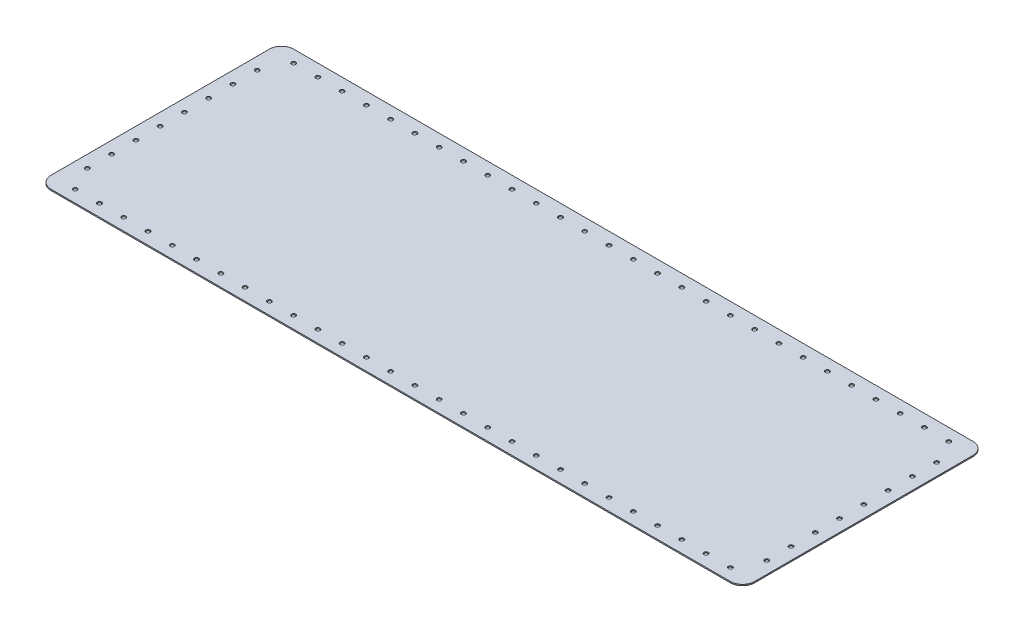
from build123d import *

# Parameters (mm, degrees)
SKETCH1_W                      = 580
SKETCH1_H                      = 200
BOSS_EXTRUDE1_DEPTH            = 1
FILLET1_R                      = 10
M3_CLEARANCE_HOLE1_AT_2_COUNT  = 2
M3_CLEARANCE_HOLE1_AT_2_PITCH  = 22.360679775
M3_CLEARANCE_HOLE1_AT_3_COUNT  = 2
M3_CLEARANCE_HOLE1_AT_3_PITCH  = 36.055512755
M3_CLEARANCE_HOLE1_AT_4_COUNT  = 2
M3_CLEARANCE_HOLE1_AT_4_PITCH  = 53.851648071
M3_CLEARANCE_HOLE1_AT_5_COUNT  = 2
M3_CLEARANCE_HOLE1_AT_5_PITCH  = 72.801098893
M3_CLEARANCE_HOLE1_AT_6_COUNT  = 2
M3_CLEARANCE_HOLE1_AT_6_PITCH  = 92.195444573
M3_CLEARANCE_HOLE1_AT_7_COUNT  = 2
M3_CLEARANCE_HOLE1_AT_7_PITCH  = 111.803398875
M3_CLEARANCE_HOLE1_AT_8_COUNT  = 2
M3_CLEARANCE_HOLE1_AT_8_PITCH  = 131.52946438
M3_CLEARANCE_HOLE1_AT_9_COUNT  = 2
M3_CLEARANCE_HOLE1_AT_9_PITCH  = 151.327459504
M3_CLEARANCE_HOLE1_AT_10_COUNT = 2
M3_CLEARANCE_HOLE1_AT_10_PITCH = 171.172427686
M3_CLEARANCE_HOLE1_AT_11_COUNT = 2
M3_CLEARANCE_HOLE1_AT_11_PITCH = 191.049731745
M3_CLEARANCE_HOLE1_AT_12_COUNT = 2
M3_CLEARANCE_HOLE1_AT_12_PITCH = 210.950231097
M3_CLEARANCE_HOLE1_AT_13_COUNT = 2
M3_CLEARANCE_HOLE1_AT_13_PITCH = 230.867927612
M3_CLEARANCE_HOLE1_AT_14_COUNT = 2
M3_CLEARANCE_HOLE1_AT_14_PITCH = 250.79872408
M3_CLEARANCE_HOLE1_AT_15_COUNT = 2
M3_CLEARANCE_HOLE1_AT_15_PITCH = 270.739727414
M3_CLEARANCE_HOLE1_AT_16_COUNT = 2
M3_CLEARANCE_HOLE1_AT_16_PITCH = 290.688837075
M3_CLEARANCE_HOLE1_AT_17_COUNT = 2
M3_CLEARANCE_HOLE1_AT_17_PITCH = 310.64449134
M3_CLEARANCE_HOLE1_AT_18_COUNT = 2
M3_CLEARANCE_HOLE1_AT_18_PITCH = 330.605505096
M3_CLEARANCE_HOLE1_AT_19_COUNT = 2
M3_CLEARANCE_HOLE1_AT_19_PITCH = 350.570962859
M3_CLEARANCE_HOLE1_AT_20_COUNT = 2
M3_CLEARANCE_HOLE1_AT_20_PITCH = 370.540146273
M3_CLEARANCE_HOLE1_AT_21_COUNT = 2
M3_CLEARANCE_HOLE1_AT_21_PITCH = 390.512483795
M3_CLEARANCE_HOLE1_AT_22_COUNT = 2
M3_CLEARANCE_HOLE1_AT_22_PITCH = 410.487515035
M3_CLEARANCE_HOLE1_AT_23_COUNT = 2
M3_CLEARANCE_HOLE1_AT_23_PITCH = 430.464865001
M3_CLEARANCE_HOLE1_AT_24_COUNT = 2
M3_CLEARANCE_HOLE1_AT_24_PITCH = 450.444225182
M3_CLEARANCE_HOLE1_AT_25_COUNT = 2
M3_CLEARANCE_HOLE1_AT_25_PITCH = 470.425339454
M3_CLEARANCE_HOLE1_AT_26_COUNT = 2
M3_CLEARANCE_HOLE1_AT_26_PITCH = 490.40799341
M3_CLEARANCE_HOLE1_AT_27_COUNT = 2
M3_CLEARANCE_HOLE1_AT_27_PITCH = 510.392006207
M3_CLEARANCE_HOLE1_AT_28_COUNT = 2
M3_CLEARANCE_HOLE1_AT_28_PITCH = 530.377224247
M3_CLEARANCE_HOLE1_AT_29_COUNT = 2
M3_CLEARANCE_HOLE1_AT_29_PITCH = 550.363516233
M3_CLEARANCE_HOLE1_AT_30_COUNT = 2
M3_CLEARANCE_HOLE1_AT_30_PITCH = 19.996953903
M3_CLEARANCE_HOLE1_AT_31_COUNT = 2
M3_CLEARANCE_HOLE1_AT_31_PITCH = 39.993907806
M3_CLEARANCE_HOLE1_AT_32_COUNT = 2
M3_CLEARANCE_HOLE1_AT_32_PITCH = 59.990861709
M3_CLEARANCE_HOLE1_AT_33_COUNT = 2
M3_CLEARANCE_HOLE1_AT_33_PITCH = 79.987815613
M3_CLEARANCE_HOLE1_AT_34_COUNT = 2
M3_CLEARANCE_HOLE1_AT_34_PITCH = 99.984769516
M3_CLEARANCE_HOLE1_AT_35_COUNT = 2
M3_CLEARANCE_HOLE1_AT_35_PITCH = 119.981723419
M3_CLEARANCE_HOLE1_AT_36_COUNT = 2
M3_CLEARANCE_HOLE1_AT_36_PITCH = 139.978677322
M3_CLEARANCE_HOLE1_AT_37_COUNT = 2
M3_CLEARANCE_HOLE1_AT_37_PITCH = 160.312195419
M3_CLEARANCE_HOLE1_AT_38_COUNT = 2
M3_CLEARANCE_HOLE1_AT_38_PITCH = 162.788205961
M3_CLEARANCE_HOLE1_AT_39_COUNT = 2
M3_CLEARANCE_HOLE1_AT_39_PITCH = 167.630546142
M3_CLEARANCE_HOLE1_AT_40_COUNT = 2
M3_CLEARANCE_HOLE1_AT_40_PITCH = 174.642491966
M3_CLEARANCE_HOLE1_AT_41_COUNT = 2
M3_CLEARANCE_HOLE1_AT_41_PITCH = 183.575597507
M3_CLEARANCE_HOLE1_AT_42_COUNT = 2
M3_CLEARANCE_HOLE1_AT_42_PITCH = 194.164878389
M3_CLEARANCE_HOLE1_AT_43_COUNT = 2
M3_CLEARANCE_HOLE1_AT_43_PITCH = 206.155281281
M3_CLEARANCE_HOLE1_AT_44_COUNT = 2
M3_CLEARANCE_HOLE1_AT_44_PITCH = 219.317121995
M3_CLEARANCE_HOLE1_AT_45_COUNT = 2
M3_CLEARANCE_HOLE1_AT_45_PITCH = 233.452350599
M3_CLEARANCE_HOLE1_AT_46_COUNT = 2
M3_CLEARANCE_HOLE1_AT_46_PITCH = 248.394846967
M3_CLEARANCE_HOLE1_AT_47_COUNT = 2
M3_CLEARANCE_HOLE1_AT_47_PITCH = 264.007575649
M3_CLEARANCE_HOLE1_AT_48_COUNT = 2
M3_CLEARANCE_HOLE1_AT_48_PITCH = 280.178514522
M3_CLEARANCE_HOLE1_AT_49_COUNT = 2
M3_CLEARANCE_HOLE1_AT_49_PITCH = 296.816441593
M3_CLEARANCE_HOLE1_AT_50_COUNT = 2
M3_CLEARANCE_HOLE1_AT_50_PITCH = 313.84709653
M3_CLEARANCE_HOLE1_AT_51_COUNT = 2
M3_CLEARANCE_HOLE1_AT_51_PITCH = 331.209903234
M3_CLEARANCE_HOLE1_AT_52_COUNT = 2
M3_CLEARANCE_HOLE1_AT_52_PITCH = 348.85527085
M3_CLEARANCE_HOLE1_AT_53_COUNT = 2
M3_CLEARANCE_HOLE1_AT_53_PITCH = 366.742416418
M3_CLEARANCE_HOLE1_AT_54_COUNT = 2
M3_CLEARANCE_HOLE1_AT_54_PITCH = 384.837628098
M3_CLEARANCE_HOLE1_AT_55_COUNT = 2
M3_CLEARANCE_HOLE1_AT_55_PITCH = 403.112887415
M3_CLEARANCE_HOLE1_AT_56_COUNT = 2
M3_CLEARANCE_HOLE1_AT_56_PITCH = 421.544778167
M3_CLEARANCE_HOLE1_AT_57_COUNT = 2
M3_CLEARANCE_HOLE1_AT_57_PITCH = 440.113621693
M3_CLEARANCE_HOLE1_AT_58_COUNT = 2
M3_CLEARANCE_HOLE1_AT_58_PITCH = 458.802789878
M3_CLEARANCE_HOLE1_AT_59_COUNT = 2
M3_CLEARANCE_HOLE1_AT_59_PITCH = 477.59815745
M3_CLEARANCE_HOLE1_AT_60_COUNT = 2
M3_CLEARANCE_HOLE1_AT_60_PITCH = 496.487663492
M3_CLEARANCE_HOLE1_AT_61_COUNT = 2
M3_CLEARANCE_HOLE1_AT_61_PITCH = 515.460958754
M3_CLEARANCE_HOLE1_AT_62_COUNT = 2
M3_CLEARANCE_HOLE1_AT_62_PITCH = 534.509120596
M3_CLEARANCE_HOLE1_AT_63_COUNT = 2
M3_CLEARANCE_HOLE1_AT_63_PITCH = 553.624421427
M3_CLEARANCE_HOLE1_AT_64_COUNT = 2
M3_CLEARANCE_HOLE1_AT_64_PITCH = 572.800139665
M3_CLEARANCE_HOLE1_AT_65_COUNT = 2
M3_CLEARANCE_HOLE1_AT_65_PITCH = 560
M3_CLEARANCE_HOLE1_AT_66_COUNT = 2
M3_CLEARANCE_HOLE1_AT_66_PITCH = 560.356920333
M3_CLEARANCE_HOLE1_AT_67_COUNT = 2
M3_CLEARANCE_HOLE1_AT_67_PITCH = 561.426319887
M3_CLEARANCE_HOLE1_AT_68_COUNT = 2
M3_CLEARANCE_HOLE1_AT_68_PITCH = 563.204140156
M3_CLEARANCE_HOLE1_AT_69_COUNT = 2
M3_CLEARANCE_HOLE1_AT_69_PITCH = 565.683701945
M3_CLEARANCE_HOLE1_AT_70_COUNT = 2
M3_CLEARANCE_HOLE1_AT_70_PITCH = 568.855828954
M3_CLEARANCE_HOLE1_AT_71_COUNT = 2
M3_CLEARANCE_HOLE1_AT_71_PITCH = 572.709013334
M3_CLEARANCE_HOLE1_AT_72_COUNT = 2
M3_CLEARANCE_HOLE1_AT_72_PITCH = 577.229616448


with BuildPart() as part:
    # Sketch1 → Boss-Extrude1 (new body)
    with BuildSketch(Plane(origin=(0, 0, 0), x_dir=(1, 0, 0), z_dir=(0, 1, 0))):
        Rectangle(SKETCH1_W, SKETCH1_H)
    extrude(amount=BOSS_EXTRUDE1_DEPTH)

    # Fillet1
    fillet1_edges = [part.edges().sort_by_distance(p)[0] for p in [
        (-290, 0.5, 100),
        (290, 0.5, 100),
        (290, 0.5, -100),
        (-290, 0.5, -100),
    ]]
    fillet(fillet1_edges, radius=FILLET1_R)

    # Sketch3 → M3 Clearance Hole1 (revolve, cut)
    with BuildSketch(Plane(origin=(280, 1, -70), x_dir=(0, 0, 1), z_dir=(1, 0, 0))):
        Polygon((0, 0), (0, 1), (1.7, 1), (1.7, 0.025), (1.725, 0), align=None)
    m3_clearance_hole1 = revolve(axis=Axis((280, 7.35, -70), (0, -1, 0)), mode=Mode.SUBTRACT)

    # M3 Clearance Hole1 at 2: M3 Clearance Hole1 ×2
    with Locations(*[Vector(-0.447213595499958, 0, -0.894427190999916) * (i * M3_CLEARANCE_HOLE1_AT_2_PITCH) for i in range(1, M3_CLEARANCE_HOLE1_AT_2_COUNT)]):
        add(m3_clearance_hole1, mode=Mode.SUBTRACT)

    # M3 Clearance Hole1 at 3: M3 Clearance Hole1 ×2
    with Locations(*[Vector(-0.8320502943378455, 0, -0.5547001962252264) * (i * M3_CLEARANCE_HOLE1_AT_3_PITCH) for i in range(1, M3_CLEARANCE_HOLE1_AT_3_COUNT)]):
        add(m3_clearance_hole1, mode=Mode.SUBTRACT)

    # M3 Clearance Hole1 at 4: M3 Clearance Hole1 ×2
    with Locations(*[Vector(-0.9284766908852612, 0, -0.37139067635409917) * (i * M3_CLEARANCE_HOLE1_AT_4_PITCH) for i in range(1, M3_CLEARANCE_HOLE1_AT_4_COUNT)]):
        add(m3_clearance_hole1, mode=Mode.SUBTRACT)

    # M3 Clearance Hole1 at 5: M3 Clearance Hole1 ×2
    with Locations(*[Vector(-0.9615239476408247, 0, -0.2747211278973728) * (i * M3_CLEARANCE_HOLE1_AT_5_PITCH) for i in range(1, M3_CLEARANCE_HOLE1_AT_5_COUNT)]):
        add(m3_clearance_hole1, mode=Mode.SUBTRACT)

    # M3 Clearance Hole1 at 6: M3 Clearance Hole1 ×2
    with Locations(*[Vector(-0.9761870601839541, 0, -0.21693045781865045) * (i * M3_CLEARANCE_HOLE1_AT_6_PITCH) for i in range(1, M3_CLEARANCE_HOLE1_AT_6_COUNT)]):
        add(m3_clearance_hole1, mode=Mode.SUBTRACT)

    # M3 Clearance Hole1 at 7: M3 Clearance Hole1 ×2
    with Locations(*[Vector(-0.9838699100999087, 0, -0.17888543819997715) * (i * M3_CLEARANCE_HOLE1_AT_7_PITCH) for i in range(1, M3_CLEARANCE_HOLE1_AT_7_COUNT)]):
        add(m3_clearance_hole1, mode=Mode.SUBTRACT)

    # M3 Clearance Hole1 at 8: M3 Clearance Hole1 ×2
    with Locations(*[Vector(-0.9883716976506182, 0, -0.1520571842539349) * (i * M3_CLEARANCE_HOLE1_AT_8_PITCH) for i in range(1, M3_CLEARANCE_HOLE1_AT_8_COUNT)]):
        add(m3_clearance_hole1, mode=Mode.SUBTRACT)

    # M3 Clearance Hole1 at 9: M3 Clearance Hole1 ×2
    with Locations(*[Vector(-0.9912279006826356, 0, -0.1321637200910116) * (i * M3_CLEARANCE_HOLE1_AT_9_PITCH) for i in range(1, M3_CLEARANCE_HOLE1_AT_9_COUNT)]):
        add(m3_clearance_hole1, mode=Mode.SUBTRACT)

    # M3 Clearance Hole1 at 10: M3 Clearance Hole1 ×2
    with Locations(*[Vector(-0.9931506043228769, 0, -0.11684124756739073) * (i * M3_CLEARANCE_HOLE1_AT_10_PITCH) for i in range(1, M3_CLEARANCE_HOLE1_AT_10_COUNT)]):
        add(m3_clearance_hole1, mode=Mode.SUBTRACT)

    # M3 Clearance Hole1 at 11: M3 Clearance Hole1 ×2
    with Locations(*[Vector(-0.9945054529214068, 0, -0.10468478451803623) * (i * M3_CLEARANCE_HOLE1_AT_11_PITCH) for i in range(1, M3_CLEARANCE_HOLE1_AT_11_COUNT)]):
        add(m3_clearance_hole1, mode=Mode.SUBTRACT)

    # M3 Clearance Hole1 at 12: M3 Clearance Hole1 ×2
    with Locations(*[Vector(-0.9954954725939529, 0, -0.09480909262798885) * (i * M3_CLEARANCE_HOLE1_AT_12_PITCH) for i in range(1, M3_CLEARANCE_HOLE1_AT_12_COUNT)]):
        add(m3_clearance_hole1, mode=Mode.SUBTRACT)

    # M3 Clearance Hole1 at 13: M3 Clearance Hole1 ×2
    with Locations(*[Vector(-0.9962405881956836, 0, -0.08662961636483535) * (i * M3_CLEARANCE_HOLE1_AT_13_PITCH) for i in range(1, M3_CLEARANCE_HOLE1_AT_13_COUNT)]):
        add(m3_clearance_hole1, mode=Mode.SUBTRACT)

    # M3 Clearance Hole1 at 14: M3 Clearance Hole1 ×2
    with Locations(*[Vector(-0.9968152785361256, 0, -0.07974522228288337) * (i * M3_CLEARANCE_HOLE1_AT_14_PITCH) for i in range(1, M3_CLEARANCE_HOLE1_AT_14_COUNT)]):
        add(m3_clearance_hole1, mode=Mode.SUBTRACT)

    # M3 Clearance Hole1 at 15: M3 Clearance Hole1 ×2
    with Locations(*[Vector(-0.9972677544567096, 0, -0.0738716855153051) * (i * M3_CLEARANCE_HOLE1_AT_15_PITCH) for i in range(1, M3_CLEARANCE_HOLE1_AT_15_COUNT)]):
        add(m3_clearance_hole1, mode=Mode.SUBTRACT)

    # M3 Clearance Hole1 at 16: M3 Clearance Hole1 ×2
    with Locations(*[Vector(-0.9976303284229836, 0, -0.06880209161537143) * (i * M3_CLEARANCE_HOLE1_AT_16_PITCH) for i in range(1, M3_CLEARANCE_HOLE1_AT_16_COUNT)]):
        add(m3_clearance_hole1, mode=Mode.SUBTRACT)

    # M3 Clearance Hole1 at 17: M3 Clearance Hole1 ×2
    with Locations(*[Vector(-0.9979253089684587, 0, -0.06438227799795831) * (i * M3_CLEARANCE_HOLE1_AT_17_PITCH) for i in range(1, M3_CLEARANCE_HOLE1_AT_17_COUNT)]):
        add(m3_clearance_hole1, mode=Mode.SUBTRACT)

    # M3 Clearance Hole1 at 18: M3 Clearance Hole1 ×2
    with Locations(*[Vector(-0.9981684966311912, 0, -0.06049506040188363) * (i * M3_CLEARANCE_HOLE1_AT_18_PITCH) for i in range(1, M3_CLEARANCE_HOLE1_AT_18_COUNT)]):
        add(m3_clearance_hole1, mode=Mode.SUBTRACT)

    # M3 Clearance Hole1 at 19: M3 Clearance Hole1 ×2
    with Locations(*[Vector(-0.9983713344239771, 0, -0.05704979053850621) * (i * M3_CLEARANCE_HOLE1_AT_19_PITCH) for i in range(1, M3_CLEARANCE_HOLE1_AT_19_COUNT)]):
        add(m3_clearance_hole1, mode=Mode.SUBTRACT)

    # M3 Clearance Hole1 at 20: M3 Clearance Hole1 ×2
    with Locations(*[Vector(-0.9985422732775088, 0, -0.05397525801499369) * (i * M3_CLEARANCE_HOLE1_AT_20_PITCH) for i in range(1, M3_CLEARANCE_HOLE1_AT_20_COUNT)]):
        add(m3_clearance_hole1, mode=Mode.SUBTRACT)

    # M3 Clearance Hole1 at 21: M3 Clearance Hole1 ×2
    with Locations(*[Vector(-0.998687663476589, 0, -0.051214751973151604) * (i * M3_CLEARANCE_HOLE1_AT_21_PITCH) for i in range(1, M3_CLEARANCE_HOLE1_AT_21_COUNT)]):
        add(m3_clearance_hole1, mode=Mode.SUBTRACT)

    # M3 Clearance Hole1 at 22: M3 Clearance Hole1 ×2
    with Locations(*[Vector(-0.9988123511248971, 0, -0.0487225537134028) * (i * M3_CLEARANCE_HOLE1_AT_22_PITCH) for i in range(1, M3_CLEARANCE_HOLE1_AT_22_COUNT)]):
        add(m3_clearance_hole1, mode=Mode.SUBTRACT)

    # M3 Clearance Hole1 at 23: M3 Clearance Hole1 ×2
    with Locations(*[Vector(-0.9989200860780661, 0, -0.046461399352461394) * (i * M3_CLEARANCE_HOLE1_AT_23_PITCH) for i in range(1, M3_CLEARANCE_HOLE1_AT_23_COUNT)]):
        add(m3_clearance_hole1, mode=Mode.SUBTRACT)

    # M3 Clearance Hole1 at 24: M3 Clearance Hole1 ×2
    with Locations(*[Vector(-0.9990138064662091, 0, -0.04440061362071359) * (i * M3_CLEARANCE_HOLE1_AT_24_PITCH) for i in range(1, M3_CLEARANCE_HOLE1_AT_24_COUNT)]):
        add(m3_clearance_hole1, mode=Mode.SUBTRACT)

    # M3 Clearance Hole1 at 25: M3 Clearance Hole1 ×2
    with Locations(*[Vector(-0.9990958406831211, 0, -0.04251471662480684) * (i * M3_CLEARANCE_HOLE1_AT_25_PITCH) for i in range(1, M3_CLEARANCE_HOLE1_AT_25_COUNT)]):
        add(m3_clearance_hole1, mode=Mode.SUBTRACT)

    # M3 Clearance Hole1 at 26: M3 Clearance Hole1 ×2
    with Locations(*[Vector(-0.9991680531005778, 0, -0.040782369514302426) * (i * M3_CLEARANCE_HOLE1_AT_26_PITCH) for i in range(1, M3_CLEARANCE_HOLE1_AT_26_COUNT)]):
        add(m3_clearance_hole1, mode=Mode.SUBTRACT)

    # M3 Clearance Hole1 at 27: M3 Clearance Hole1 ×2
    with Locations(*[Vector(-0.9992319507315429, 0, -0.03918556669534777) * (i * M3_CLEARANCE_HOLE1_AT_27_PITCH) for i in range(1, M3_CLEARANCE_HOLE1_AT_27_COUNT)]):
        add(m3_clearance_hole1, mode=Mode.SUBTRACT)

    # M3 Clearance Hole1 at 28: M3 Clearance Hole1 ×2
    with Locations(*[Vector(-0.999288762356679, 0, -0.03770900990024518) * (i * M3_CLEARANCE_HOLE1_AT_28_PITCH) for i in range(1, M3_CLEARANCE_HOLE1_AT_28_COUNT)]):
        add(m3_clearance_hole1, mode=Mode.SUBTRACT)

    # M3 Clearance Hole1 at 29: M3 Clearance Hole1 ×2
    with Locations(*[Vector(-0.9993394979464324, 0, -0.03633961810713613) * (i * M3_CLEARANCE_HOLE1_AT_29_PITCH) for i in range(1, M3_CLEARANCE_HOLE1_AT_29_COUNT)]):
        add(m3_clearance_hole1, mode=Mode.SUBTRACT)

    # M3 Clearance Hole1 at 30: M3 Clearance Hole1 ×2
    with Locations(*[(0, 0, i * M3_CLEARANCE_HOLE1_AT_30_PITCH) for i in range(1, M3_CLEARANCE_HOLE1_AT_30_COUNT)]):
        add(m3_clearance_hole1, mode=Mode.SUBTRACT)

    # M3 Clearance Hole1 at 31: M3 Clearance Hole1 ×2
    with Locations(*[(0, 0, i * M3_CLEARANCE_HOLE1_AT_31_PITCH) for i in range(1, M3_CLEARANCE_HOLE1_AT_31_COUNT)]):
        add(m3_clearance_hole1, mode=Mode.SUBTRACT)

    # M3 Clearance Hole1 at 32: M3 Clearance Hole1 ×2
    with Locations(*[(0, 0, i * M3_CLEARANCE_HOLE1_AT_32_PITCH) for i in range(1, M3_CLEARANCE_HOLE1_AT_32_COUNT)]):
        add(m3_clearance_hole1, mode=Mode.SUBTRACT)

    # M3 Clearance Hole1 at 33: M3 Clearance Hole1 ×2
    with Locations(*[(0, 0, i * M3_CLEARANCE_HOLE1_AT_33_PITCH) for i in range(1, M3_CLEARANCE_HOLE1_AT_33_COUNT)]):
        add(m3_clearance_hole1, mode=Mode.SUBTRACT)

    # M3 Clearance Hole1 at 34: M3 Clearance Hole1 ×2
    with Locations(*[(0, 0, i * M3_CLEARANCE_HOLE1_AT_34_PITCH) for i in range(1, M3_CLEARANCE_HOLE1_AT_34_COUNT)]):
        add(m3_clearance_hole1, mode=Mode.SUBTRACT)

    # M3 Clearance Hole1 at 35: M3 Clearance Hole1 ×2
    with Locations(*[(0, 0, i * M3_CLEARANCE_HOLE1_AT_35_PITCH) for i in range(1, M3_CLEARANCE_HOLE1_AT_35_COUNT)]):
        add(m3_clearance_hole1, mode=Mode.SUBTRACT)

    # M3 Clearance Hole1 at 36: M3 Clearance Hole1 ×2
    with Locations(*[(0, 0, i * M3_CLEARANCE_HOLE1_AT_36_PITCH) for i in range(1, M3_CLEARANCE_HOLE1_AT_36_COUNT)]):
        add(m3_clearance_hole1, mode=Mode.SUBTRACT)

    # M3 Clearance Hole1 at 37: M3 Clearance Hole1 ×2
    with Locations(*[Vector(-0.06237828615518055, 0, 0.9980525784828886) * (i * M3_CLEARANCE_HOLE1_AT_37_PITCH) for i in range(1, M3_CLEARANCE_HOLE1_AT_37_COUNT)]):
        add(m3_clearance_hole1, mode=Mode.SUBTRACT)

    # M3 Clearance Hole1 at 38: M3 Clearance Hole1 ×2
    with Locations(*[Vector(-0.18428853505018555, 0, 0.9828721869343219) * (i * M3_CLEARANCE_HOLE1_AT_38_PITCH) for i in range(1, M3_CLEARANCE_HOLE1_AT_38_COUNT)]):
        add(m3_clearance_hole1, mode=Mode.SUBTRACT)

    # M3 Clearance Hole1 at 39: M3 Clearance Hole1 ×2
    with Locations(*[Vector(-0.29827499313594735, 0, 0.9544799780350296) * (i * M3_CLEARANCE_HOLE1_AT_39_PITCH) for i in range(1, M3_CLEARANCE_HOLE1_AT_39_COUNT)]):
        add(m3_clearance_hole1, mode=Mode.SUBTRACT)

    # M3 Clearance Hole1 at 40: M3 Clearance Hole1 ×2
    with Locations(*[Vector(-0.4008188340197085, 0, 0.9161573349021888) * (i * M3_CLEARANCE_HOLE1_AT_40_PITCH) for i in range(1, M3_CLEARANCE_HOLE1_AT_40_COUNT)]):
        add(m3_clearance_hole1, mode=Mode.SUBTRACT)

    # M3 Clearance Hole1 at 41: M3 Clearance Hole1 ×2
    with Locations(*[Vector(-0.4902612396325603, 0, 0.8715755371245486) * (i * M3_CLEARANCE_HOLE1_AT_41_PITCH) for i in range(1, M3_CLEARANCE_HOLE1_AT_41_COUNT)]):
        add(m3_clearance_hole1, mode=Mode.SUBTRACT)

    # M3 Clearance Hole1 at 42: M3 Clearance Hole1 ×2
    with Locations(*[Vector(-0.566528822887067, 0, 0.8240419241993664) * (i * M3_CLEARANCE_HOLE1_AT_42_PITCH) for i in range(1, M3_CLEARANCE_HOLE1_AT_42_COUNT)]):
        add(m3_clearance_hole1, mode=Mode.SUBTRACT)

    # M3 Clearance Hole1 at 43: M3 Clearance Hole1 ×2
    with Locations(*[Vector(-0.6305926250944677, 0, 0.776114000116264) * (i * M3_CLEARANCE_HOLE1_AT_43_PITCH) for i in range(1, M3_CLEARANCE_HOLE1_AT_43_COUNT)]):
        add(m3_clearance_hole1, mode=Mode.SUBTRACT)

    # M3 Clearance Hole1 at 44: M3 Clearance Hole1 ×2
    with Locations(*[Vector(-0.6839411288813322, 0, 0.7295372041400829) * (i * M3_CLEARANCE_HOLE1_AT_44_PITCH) for i in range(1, M3_CLEARANCE_HOLE1_AT_44_COUNT)]):
        add(m3_clearance_hole1, mode=Mode.SUBTRACT)

    # M3 Clearance Hole1 at 45: M3 Clearance Hole1 ×2
    with Locations(*[Vector(-0.7281999926928054, 0, 0.6853646990049884) * (i * M3_CLEARANCE_HOLE1_AT_45_PITCH) for i in range(1, M3_CLEARANCE_HOLE1_AT_45_COUNT)]):
        add(m3_clearance_hole1, mode=Mode.SUBTRACT)

    # M3 Clearance Hole1 at 46: M3 Clearance Hole1 ×2
    with Locations(*[Vector(-0.7649111981170534, 0, 0.6441357457827767) * (i * M3_CLEARANCE_HOLE1_AT_46_PITCH) for i in range(1, M3_CLEARANCE_HOLE1_AT_46_COUNT)]):
        add(m3_clearance_hole1, mode=Mode.SUBTRACT)

    # M3 Clearance Hole1 at 47: M3 Clearance Hole1 ×2
    with Locations(*[Vector(-0.7954317200325013, 0, 0.6060432152628528) * (i * M3_CLEARANCE_HOLE1_AT_47_PITCH) for i in range(1, M3_CLEARANCE_HOLE1_AT_47_COUNT)]):
        add(m3_clearance_hole1, mode=Mode.SUBTRACT)

    # M3 Clearance Hole1 at 48: M3 Clearance Hole1 ×2
    with Locations(*[Vector(-0.8209052017854899, 0, 0.5710644881985959) * (i * M3_CLEARANCE_HOLE1_AT_48_PITCH) for i in range(1, M3_CLEARANCE_HOLE1_AT_48_COUNT)]):
        add(m3_clearance_hole1, mode=Mode.SUBTRACT)

    # M3 Clearance Hole1 at 49: M3 Clearance Hole1 ×2
    with Locations(*[Vector(-0.842271400661514, 0, 0.5390536964233632) * (i * M3_CLEARANCE_HOLE1_AT_49_PITCH) for i in range(1, M3_CLEARANCE_HOLE1_AT_49_COUNT)]):
        add(m3_clearance_hole1, mode=Mode.SUBTRACT)

    # M3 Clearance Hole1 at 50: M3 Clearance Hole1 ×2
    with Locations(*[Vector(-0.8602915336341769, 0, 0.5098023903017286) * (i * M3_CLEARANCE_HOLE1_AT_50_PITCH) for i in range(1, M3_CLEARANCE_HOLE1_AT_50_COUNT)]):
        add(m3_clearance_hole1, mode=Mode.SUBTRACT)

    # M3 Clearance Hole1 at 51: M3 Clearance Hole1 ×2
    with Locations(*[Vector(-0.8755776840267968, 0, 0.48307734291133014) * (i * M3_CLEARANCE_HOLE1_AT_51_PITCH) for i in range(1, M3_CLEARANCE_HOLE1_AT_51_COUNT)]):
        add(m3_clearance_hole1, mode=Mode.SUBTRACT)

    # M3 Clearance Hole1 at 52: M3 Clearance Hole1 ×2
    with Locations(*[Vector(-0.8886206570548664, 0, 0.4586429197702475) * (i * M3_CLEARANCE_HOLE1_AT_52_PITCH) for i in range(1, M3_CLEARANCE_HOLE1_AT_52_COUNT)]):
        add(m3_clearance_hole1, mode=Mode.SUBTRACT)

    # M3 Clearance Hole1 at 53: M3 Clearance Hole1 ×2
    with Locations(*[Vector(-0.899814107196202, 0, 0.4362735065193645) * (i * M3_CLEARANCE_HOLE1_AT_53_PITCH) for i in range(1, M3_CLEARANCE_HOLE1_AT_53_COUNT)]):
        add(m3_clearance_hole1, mode=Mode.SUBTRACT)

    # M3 Clearance Hole1 at 54: M3 Clearance Hole1 ×2
    with Locations(*[Vector(-0.9094744755858025, 0, 0.41575976026778927) * (i * M3_CLEARANCE_HOLE1_AT_54_PITCH) for i in range(1, M3_CLEARANCE_HOLE1_AT_54_COUNT)]):
        add(m3_clearance_hole1, mode=Mode.SUBTRACT)

    # M3 Clearance Hole1 at 55: M3 Clearance Hole1 ×2
    with Locations(*[Vector(-0.9178570359601449, 0, 0.39691115068546173) * (i * M3_CLEARANCE_HOLE1_AT_55_PITCH) for i in range(1, M3_CLEARANCE_HOLE1_AT_55_COUNT)]):
        add(m3_clearance_hole1, mode=Mode.SUBTRACT)

    # M3 Clearance Hole1 at 56: M3 Clearance Hole1 ×2
    with Locations(*[Vector(-0.9251686183747481, 0, 0.3795563562563006) * (i * M3_CLEARANCE_HOLE1_AT_56_PITCH) for i in range(1, M3_CLEARANCE_HOLE1_AT_56_COUNT)]):
        add(m3_clearance_hole1, mode=Mode.SUBTRACT)

    # M3 Clearance Hole1 at 57: M3 Clearance Hole1 ×2
    with Locations(*[Vector(-0.9315776194850625, 0, 0.36354248565270086) * (i * M3_CLEARANCE_HOLE1_AT_57_PITCH) for i in range(1, M3_CLEARANCE_HOLE1_AT_57_COUNT)]):
        add(m3_clearance_hole1, mode=Mode.SUBTRACT)

    # M3 Clearance Hole1 at 58: M3 Clearance Hole1 ×2
    with Locations(*[Vector(-0.937221851057564, 0, 0.34873371202141273) * (i * M3_CLEARANCE_HOLE1_AT_58_PITCH) for i in range(1, M3_CLEARANCE_HOLE1_AT_58_COUNT)]):
        add(m3_clearance_hole1, mode=Mode.SUBTRACT)

    # M3 Clearance Hole1 at 59: M3 Clearance Hole1 ×2
    with Locations(*[Vector(-0.9422146902791426, 0, 0.33500966765479984) * (i * M3_CLEARANCE_HOLE1_AT_59_PITCH) for i in range(1, M3_CLEARANCE_HOLE1_AT_59_COUNT)]):
        add(m3_clearance_hole1, mode=Mode.SUBTRACT)

    # M3 Clearance Hole1 at 60: M3 Clearance Hole1 ×2
    with Locations(*[Vector(-0.946649906050146, 0, 0.3222637978042985) * (i * M3_CLEARANCE_HOLE1_AT_60_PITCH) for i in range(1, M3_CLEARANCE_HOLE1_AT_60_COUNT)]):
        add(m3_clearance_hole1, mode=Mode.SUBTRACT)

    # M3 Clearance Hole1 at 61: M3 Clearance Hole1 ×2
    with Locations(*[Vector(-0.9506054564909825, 0, 0.3104017817113346) * (i * M3_CLEARANCE_HOLE1_AT_61_PITCH) for i in range(1, M3_CLEARANCE_HOLE1_AT_61_COUNT)]):
        add(m3_clearance_hole1, mode=Mode.SUBTRACT)

    # M3 Clearance Hole1 at 62: M3 Clearance Hole1 ×2
    with Locations(*[Vector(-0.9541464875877249, 0, 0.2993400745373189) * (i * M3_CLEARANCE_HOLE1_AT_62_PITCH) for i in range(1, M3_CLEARANCE_HOLE1_AT_62_COUNT)]):
        add(m3_clearance_hole1, mode=Mode.SUBTRACT)

    # M3 Clearance Hole1 at 63: M3 Clearance Hole1 ×2
    with Locations(*[Vector(-0.957327710786716, 0, 0.2890045919356058) * (i * M3_CLEARANCE_HOLE1_AT_63_PITCH) for i in range(1, M3_CLEARANCE_HOLE1_AT_63_COUNT)]):
        add(m3_clearance_hole1, mode=Mode.SUBTRACT)

    # M3 Clearance Hole1 at 64: M3 Clearance Hole1 ×2
    with Locations(*[Vector(-0.9601952966035773, 0, 0.2793295408301249) * (i * M3_CLEARANCE_HOLE1_AT_64_PITCH) for i in range(1, M3_CLEARANCE_HOLE1_AT_64_COUNT)]):
        add(m3_clearance_hole1, mode=Mode.SUBTRACT)

    # M3 Clearance Hole1 at 65: M3 Clearance Hole1 ×2
    with Locations(*[(-i * M3_CLEARANCE_HOLE1_AT_65_PITCH, 0, 0) for i in range(1, M3_CLEARANCE_HOLE1_AT_65_COUNT)]):
        add(m3_clearance_hole1, mode=Mode.SUBTRACT)

    # M3 Clearance Hole1 at 66: M3 Clearance Hole1 ×2
    with Locations(*[Vector(-0.9993630482281312, 0, 0.035686101442691485) * (i * M3_CLEARANCE_HOLE1_AT_66_PITCH) for i in range(1, M3_CLEARANCE_HOLE1_AT_66_COUNT)]):
        add(m3_clearance_hole1, mode=Mode.SUBTRACT)

    # M3 Clearance Hole1 at 67: M3 Clearance Hole1 ×2
    with Locations(*[Vector(-0.9974594709292047, 0, 0.07123625378717698) * (i * M3_CLEARANCE_HOLE1_AT_67_PITCH) for i in range(1, M3_CLEARANCE_HOLE1_AT_67_COUNT)]):
        add(m3_clearance_hole1, mode=Mode.SUBTRACT)

    # M3 Clearance Hole1 at 68: M3 Clearance Hole1 ×2
    with Locations(*[Vector(-0.9943108725107846, 0, 0.10651708223023358) * (i * M3_CLEARANCE_HOLE1_AT_68_PITCH) for i in range(1, M3_CLEARANCE_HOLE1_AT_68_COUNT)]):
        add(m3_clearance_hole1, mode=Mode.SUBTRACT)

    # M3 Clearance Hole1 at 69: M3 Clearance Hole1 ×2
    with Locations(*[Vector(-0.9899525089273628, 0, 0.14140024776647261) * (i * M3_CLEARANCE_HOLE1_AT_69_PITCH) for i in range(1, M3_CLEARANCE_HOLE1_AT_69_COUNT)]):
        add(m3_clearance_hole1, mode=Mode.SUBTRACT)

    # M3 Clearance Hole1 at 70: M3 Clearance Hole1 ×2
    with Locations(*[Vector(-0.9844322084728987, 0, 0.17576469190702523) * (i * M3_CLEARANCE_HOLE1_AT_70_PITCH) for i in range(1, M3_CLEARANCE_HOLE1_AT_70_COUNT)]):
        add(m3_clearance_hole1, mode=Mode.SUBTRACT)

    # M3 Clearance Hole1 at 71: M3 Clearance Hole1 ×2
    with Locations(*[Vector(-0.9778089517738326, 0, 0.20949857715736084) * (i * M3_CLEARANCE_HOLE1_AT_71_PITCH) for i in range(1, M3_CLEARANCE_HOLE1_AT_71_COUNT)]):
        add(m3_clearance_hole1, mode=Mode.SUBTRACT)

    # M3 Clearance Hole1 at 72: M3 Clearance Hole1 ×2
    with Locations(*[Vector(-0.9701511912121008, 0, 0.2425008581216608) * (i * M3_CLEARANCE_HOLE1_AT_72_PITCH) for i in range(1, M3_CLEARANCE_HOLE1_AT_72_COUNT)]):
        add(m3_clearance_hole1, mode=Mode.SUBTRACT)


solid = part.part
